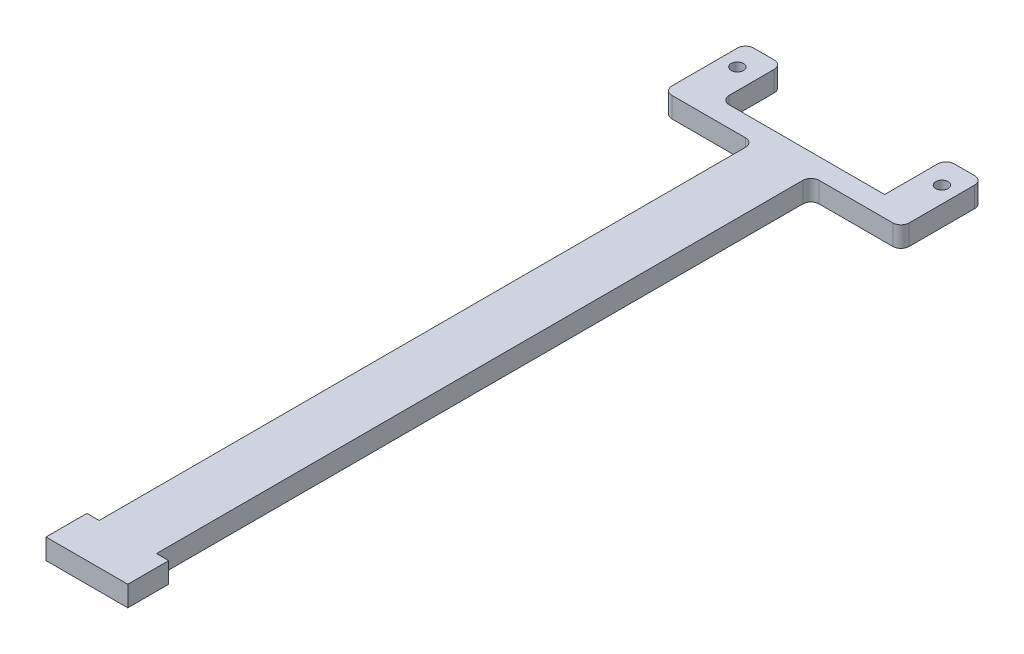
from build123d import *

# Parameters (mm, degrees)
BOSS_EXTRUDE1_DEPTH = 5
SKETCH2_R           = 1.5
SKETCH2_W           = 40
SKETCH2_H           = 15
CUT_EXTRUDE1_DEPTH  = 10
FILLET1_R           = 2


with BuildPart() as part:
    # Sketch1 → Boss-Extrude1 (new body)
    with BuildSketch(Plane(origin=(0, 0, 0), x_dir=(1, 0, 0), z_dir=(0, 1, 0))):
        Polygon((9, -10), (9, 0), (6, 0), (6, 160), (28, 160), (28, 180), (-30, 180), (-30, 160), (-8, 160), (-8, 0), (-11, 0), (-11, -10), align=None)
    extrude(amount=BOSS_EXTRUDE1_DEPTH)

    # Sketch2 → Cut-Extrude1 (cut)
    with BuildSketch(Plane(origin=(0, 5, 0), x_dir=(1, 0, 0), z_dir=(0, 1, 0))):
        with Locations((-26, 174)):
            Circle(SKETCH2_R)
        with Locations((24, 174)):
            Circle(SKETCH2_R)
        with Locations((-1, 172.5)):
            Rectangle(SKETCH2_W, SKETCH2_H)
    extrude(amount=-CUT_EXTRUDE1_DEPTH, mode=Mode.SUBTRACT)

    # Fillet1
    fillet1_edges = [part.edges().sort_by_distance(p)[0] for p in [
        (6, 2.5, -160),
        (-8, 2.5, -160),
        (-30, 2.5, -160),
        (28, 2.5, -160),
        (28, 2.5, -180),
        (19, 2.5, -180),
        (-21, 2.5, -165),
        (-21, 2.5, -180),
        (-30, 2.5, -180),
    ]]
    fillet(fillet1_edges, radius=FILLET1_R)


solid = part.part
